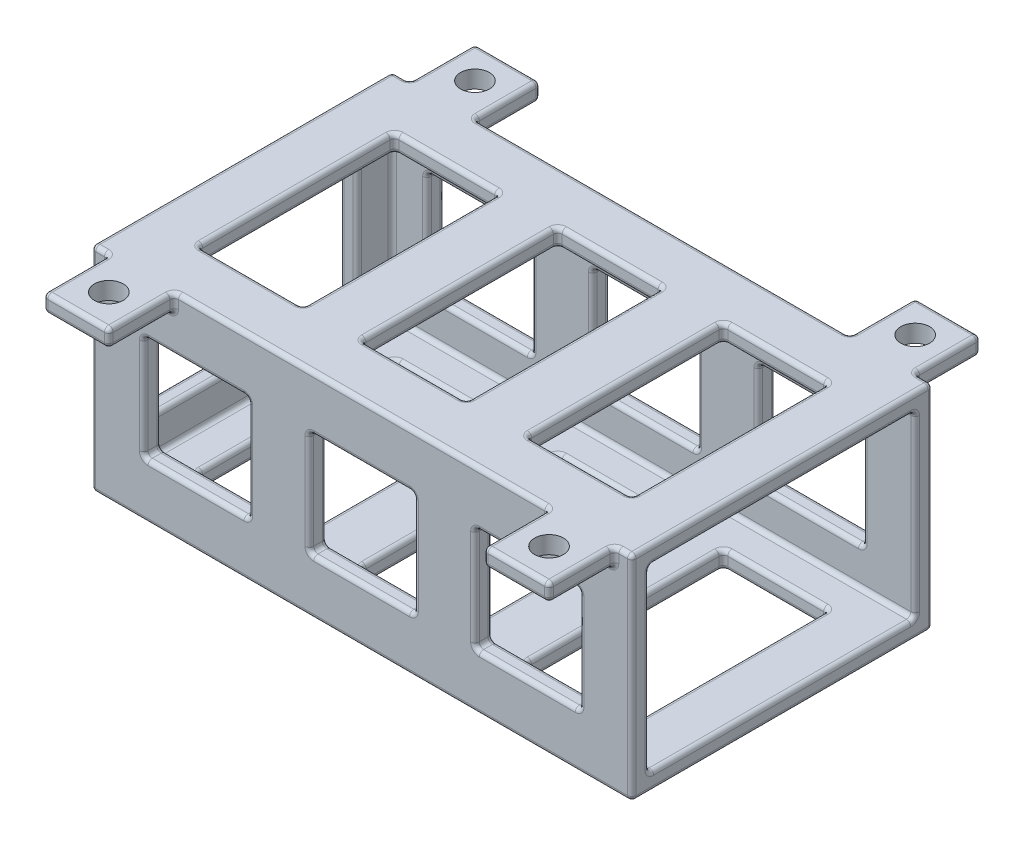
from build123d import *

# Parameters (mm, degrees)
SKETCH1_W           = 34.5
SKETCH1_H           = 24.5
BOSS_EXTRUDE1_DEPTH = 31
SHELL1_T            = -2
SKETCH2_W           = 7.5
SKETCH2_H           = 7.5
SKETCH2_R           = 1.65
BOSS_EXTRUDE2_DEPTH = 2
CUT_EXTRUDE3_REACH  = 55.62
SKETCH5_W           = 12
SKETCH5_H           = 12
CUT_EXTRUDE4_REACH  = 48.624
SKETCH6_W           = 12
SKETCH6_H           = 22.5
SKETCH7_W           = 22.5
SKETCH7_H           = 12.5
CUT_EXTRUDE5_DEPTH  = 2
FILLET1_R           = 0.5


with BuildPart() as part:
    # Sketch1 → Boss-Extrude1 (new, symmetric)
    with BuildSketch(Plane(origin=(0, 0, 0), x_dir=(0, 0, -1), z_dir=(1, 0, 0))):
        Rectangle(SKETCH1_W, SKETCH1_H)
    extrude(amount=BOSS_EXTRUDE1_DEPTH, both=True)

    # Shell1
    shell1_openings = [part.faces().sort_by_distance(p)[0] for p in [
        (31, 0, 0),
    ]]
    offset(amount=SHELL1_T, openings=shell1_openings, kind=Kind.INTERSECTION)

    # Sketch2 → Boss-Extrude2 (add)
    # profile 1 of 4: a face of its own
    with BuildSketch(Plane(origin=(0, 12.25, 0), x_dir=(1, 0, 0), z_dir=(0, 1, 0))):
        with Locations((-25.25, 21)):
            Rectangle(SKETCH2_W, SKETCH2_H)
        with Locations(Location((-25.25, 21, 0), (0, 0, 270))):
            Circle(SKETCH2_R, mode=Mode.SUBTRACT)
    # profile 2 of 4: a face of its own
    with BuildSketch(Plane(origin=(0, 12.25, 0), x_dir=(1, 0, 0), z_dir=(0, 1, 0))):
        with Locations((25.25, 21)):
            Rectangle(SKETCH2_W, SKETCH2_H)
        with Locations(Location((25.25, 21, 0), (0, 0, 90))):
            Circle(SKETCH2_R, mode=Mode.SUBTRACT)
    # profile 3 of 4: a face of its own
    with BuildSketch(Plane(origin=(0, 12.25, 0), x_dir=(1, 0, 0), z_dir=(0, 1, 0))):
        with Locations((25.25, -21)):
            Rectangle(SKETCH2_W, SKETCH2_H)
        with Locations(Location((25.25, -21, 0), (0, 0, 270))):
            Circle(SKETCH2_R, mode=Mode.SUBTRACT)
    # profile 4 of 4: a face of its own
    with BuildSketch(Plane(origin=(0, 12.25, 0), x_dir=(1, 0, 0), z_dir=(0, 1, 0))):
        with Locations((-25.25, -21)):
            Rectangle(SKETCH2_W, SKETCH2_H)
        with Locations(Location((-25.25, -21, 0), (0, 0, 90))):
            Circle(SKETCH2_R, mode=Mode.SUBTRACT)
    extrude(amount=-BOSS_EXTRUDE2_DEPTH)

    # Cut-Extrude3: up to this face of the body (flat: up to its plane)
    cut_extrude3_end = Plane(part.part.faces().sort_by_distance((0, -0.226662189, 17.25))[0])
    # Sketch5 → Cut-Extrude3 (cut, up to the picked face)
    with BuildSketch(Plane(origin=(0, 0, -17.25), x_dir=(-1, 0, 0), z_dir=(0, 0, -1)), mode=Mode.PRIVATE) as cut_extrude3_sk1:
        with Locations((-19, 0)):
            Rectangle(SKETCH5_W, SKETCH5_H)
    cut_extrude3_tool1 = split(extrude(cut_extrude3_sk1.sketch, amount=-CUT_EXTRUDE3_REACH, mode=Mode.PRIVATE), bisect_by=cut_extrude3_end, keep=Keep.BOTH, mode=Mode.PRIVATE)
    # Sketch5 → Cut-Extrude3 (cut, up to the picked face)
    with BuildSketch(Plane(origin=(0, 0, -17.25), x_dir=(-1, 0, 0), z_dir=(0, 0, -1)), mode=Mode.PRIVATE) as cut_extrude3_sk2:
        Rectangle(SKETCH5_W, SKETCH5_H)
    cut_extrude3_tool2 = split(extrude(cut_extrude3_sk2.sketch, amount=-CUT_EXTRUDE3_REACH, mode=Mode.PRIVATE), bisect_by=cut_extrude3_end, keep=Keep.BOTH, mode=Mode.PRIVATE)
    # Sketch5 → Cut-Extrude3 (cut, up to the picked face)
    with BuildSketch(Plane(origin=(0, 0, -17.25), x_dir=(-1, 0, 0), z_dir=(0, 0, -1)), mode=Mode.PRIVATE) as cut_extrude3_sk3:
        with Locations((19, 0)):
            Rectangle(SKETCH5_W, SKETCH5_H)
    cut_extrude3_tool3 = split(extrude(cut_extrude3_sk3.sketch, amount=-CUT_EXTRUDE3_REACH, mode=Mode.PRIVATE), bisect_by=cut_extrude3_end, keep=Keep.BOTH, mode=Mode.PRIVATE)
    add(cut_extrude3_tool1.solids().sort_by(Axis((19, 0, -17.25), (0, 0, 1)))[0], mode=Mode.SUBTRACT)
    add(cut_extrude3_tool2.solids().sort_by(Axis((0, 0, -17.25), (0, 0, 1)))[0], mode=Mode.SUBTRACT)
    add(cut_extrude3_tool3.solids().sort_by(Axis((-19, 0, -17.25), (0, 0, 1)))[0], mode=Mode.SUBTRACT)

    # Cut-Extrude4: up to this face of the body (flat: up to its plane)
    cut_extrude4_end = Plane(part.part.faces().sort_by_distance((0, -12.25, 0))[0])
    # Sketch6 → Cut-Extrude4 (cut, up to the picked face)
    with BuildSketch(Plane(origin=(0, 12.25, 0), x_dir=(1, 0, 0), z_dir=(0, 1, 0)), mode=Mode.PRIVATE) as cut_extrude4_sk1:
        with Locations((-18.733429366, 0)):
            Rectangle(SKETCH6_W, SKETCH6_H)
    cut_extrude4_tool1 = split(extrude(cut_extrude4_sk1.sketch, amount=-CUT_EXTRUDE4_REACH, mode=Mode.PRIVATE), bisect_by=cut_extrude4_end, keep=Keep.BOTH, mode=Mode.PRIVATE)
    # Sketch6 → Cut-Extrude4 (cut, up to the picked face)
    with BuildSketch(Plane(origin=(0, 12.25, 0), x_dir=(1, 0, 0), z_dir=(0, 1, 0)), mode=Mode.PRIVATE) as cut_extrude4_sk2:
        with Locations((19, 0)):
            Rectangle(SKETCH6_W, SKETCH6_H)
    cut_extrude4_tool2 = split(extrude(cut_extrude4_sk2.sketch, amount=-CUT_EXTRUDE4_REACH, mode=Mode.PRIVATE), bisect_by=cut_extrude4_end, keep=Keep.BOTH, mode=Mode.PRIVATE)
    # Sketch6 → Cut-Extrude4 (cut, up to the picked face)
    with BuildSketch(Plane(origin=(0, 12.25, 0), x_dir=(1, 0, 0), z_dir=(0, 1, 0)), mode=Mode.PRIVATE) as cut_extrude4_sk3:
        Rectangle(SKETCH6_W, SKETCH6_H)
    cut_extrude4_tool3 = split(extrude(cut_extrude4_sk3.sketch, amount=-CUT_EXTRUDE4_REACH, mode=Mode.PRIVATE), bisect_by=cut_extrude4_end, keep=Keep.BOTH, mode=Mode.PRIVATE)
    add(cut_extrude4_tool1.solids().sort_by(Axis((-18.733429, 12.25, 0), (0, -1, 0)))[0], mode=Mode.SUBTRACT)
    add(cut_extrude4_tool2.solids().sort_by(Axis((19, 12.25, 0), (0, -1, 0)))[0], mode=Mode.SUBTRACT)
    add(cut_extrude4_tool3.solids().sort_by(Axis((0, 12.25, 0), (0, -1, 0)))[0], mode=Mode.SUBTRACT)

    # Sketch7 → Cut-Extrude5 (cut)
    with BuildSketch(Plane.ZY.offset(31)):
        Rectangle(SKETCH7_W, SKETCH7_H)
    extrude(amount=-CUT_EXTRUDE5_DEPTH, mode=Mode.SUBTRACT)

    # Fillet1
    fillet1_edges = [part.edges().sort_by_distance(p)[0] for p in [
        (13, 6, 16.25),
        (13, 0, 15.25),
        (13, 0, 17.25),
        (25, 6, 16.25),
        (19, 6, 15.25),
        (19, 6, 17.25),
        (25, -6, 16.25),
        (25, 0, 15.25),
        (25, 0, 17.25),
        (13, -6, 16.25),
        (19, -6, 15.25),
        (19, -6, 17.25),
        (13, 6, -16.25),
        (13, 0, -17.25),
        (25, 6, -16.25),
        (19, 6, -17.25),
        (25, -6, -16.25),
        (25, 0, -17.25),
        (13, -6, -16.25),
        (19, -6, -17.25),
        (-6, 6, 16.25),
        (-6, 0, 15.25),
        (-6, 0, 17.25),
        (6, 6, 16.25),
        (0, 6, 15.25),
        (0, 6, 17.25),
        (6, -6, 16.25),
        (6, 0, 15.25),
        (6, 0, 17.25),
        (-6, -6, 16.25),
        (0, -6, 15.25),
        (0, -6, 17.25),
        (-6, 6, -16.25),
        (-6, 0, -17.25),
        (6, 6, -16.25),
        (0, 6, -17.25),
        (6, -6, -16.25),
        (6, 0, -17.25),
        (-6, -6, -16.25),
        (0, -6, -17.25),
        (-25, 6, 16.25),
        (-25, 0, 15.25),
        (-25, 0, 17.25),
        (31, 0, -17.25),
        (-13, 6, 16.25),
        (-19, 6, 15.25),
        (-19, 6, 17.25),
        (-13, -6, 16.25),
        (-13, 0, 15.25),
        (-13, 0, 17.25),
        (-25, -6, 16.25),
        (-19, -6, 15.25),
        (-19, -6, 17.25),
        (-25, 6, -16.25),
        (-25, 0, -17.25),
        (-13, 6, -16.25),
        (-19, 6, -17.25),
        (-13, -6, -16.25),
        (-13, 0, -17.25),
        (-25, -6, -16.25),
        (-19, -6, -17.25),
        (-29, 0, 15.25),
        (1, 10.25, 15.25),
        (-29, -10.25, 0),
        (1, -10.25, 15.25),
        (6, 10.25, 0),
        (0, 10.25, -11.25),
        (31, 12.25, 0),
        (-29, 0, -15.25),
        (-6, 10.25, 0),
        (0, 10.25, 11.25),
        (1, -10.25, -15.25),
        (25, 10.25, 0),
        (19, 10.25, -11.25),
        (-29, 10.25, 0),
        (13, 10.25, 0),
        (19, 10.25, 11.25),
        (1, 10.25, -15.25),
        (-12.733429366, 10.25, 0),
        (-18.733429366, 10.25, -11.25),
        (31, 0, 15.25),
        (-24.733429366, 10.25, 0),
        (-18.733429366, 10.25, 11.25),
        (31, -10.25, 0),
        (31, 0, -15.25),
        (31, 10.25, 0),
        (-18.733429366, -10.25, 11.25),
        (-12.733429366, -11.25, 11.25),
        (-24.733429366, -10.25, 0),
        (-24.733429366, -11.25, 11.25),
        (-18.733429366, -10.25, -11.25),
        (-24.733429366, -11.25, -11.25),
        (-12.733429366, -10.25, 0),
        (-12.733429366, -11.25, -11.25),
        (-12.733429366, 11.25, 11.25),
        (-24.733429366, 11.25, 11.25),
        (-24.733429366, 11.25, -11.25),
        (-12.733429366, 11.25, -11.25),
        (-18.733429366, 12.25, 11.25),
        (-12.733429366, 12.25, 0),
        (-18.733429366, 12.25, -11.25),
        (-24.733429366, 12.25, 0),
        (-18.733429366, -12.25, 11.25),
        (-24.733429366, -12.25, 0),
        (-18.733429366, -12.25, -11.25),
        (-12.733429366, -12.25, 0),
        (19, -10.25, 11.25),
        (25, -11.25, 11.25),
        (13, -10.25, 0),
        (13, -11.25, 11.25),
        (19, -10.25, -11.25),
        (13, -11.25, -11.25),
        (25, -10.25, 0),
        (25, -11.25, -11.25),
        (25, 11.25, 11.25),
        (13, 11.25, 11.25),
        (13, 11.25, -11.25),
        (25, 11.25, -11.25),
        (19, 12.25, 11.25),
        (25, 12.25, 0),
        (19, 12.25, -11.25),
        (13, 12.25, 0),
        (19, -12.25, 11.25),
        (13, -12.25, 0),
        (19, -12.25, -11.25),
        (25, -12.25, 0),
        (0, -10.25, 11.25),
        (6, -11.25, 11.25),
        (-6, -10.25, 0),
        (-6, -11.25, 11.25),
        (0, -10.25, -11.25),
        (-6, -11.25, -11.25),
        (6, -10.25, 0),
        (6, -11.25, -11.25),
        (6, 11.25, 11.25),
        (-6, 11.25, 11.25),
        (-6, 11.25, -11.25),
        (6, 11.25, -11.25),
        (0, 12.25, 11.25),
        (6, 12.25, 0),
        (0, 12.25, -11.25),
        (-6, 12.25, 0),
        (0, -12.25, 11.25),
        (-6, -12.25, 0),
        (0, -12.25, -11.25),
        (6, -12.25, 0),
        (-31, 6.25, 0),
        (-31, 0, -11.25),
        (-31, -6.25, 0),
        (-31, 0, 11.25),
        (-29, 0, -11.25),
        (-29, -6.25, 0),
        (-29, 0, 11.25),
        (-29, 6.25, 0),
        (-30, 12.25, -17.25),
        (-29, 10.25, -21),
        (-29, 11.25, -17.25),
        (-25.25, 10.25, -24.75),
        (-29, 11.25, -24.75),
        (-21.5, 10.25, -21),
        (-21.5, 11.25, -24.75),
        (-25.25, 10.25, -17.25),
        (-21.5, 11.25, -17.25),
        (-29, 12.25, -21),
        (-21.5, 12.25, -21),
        (-25.25, 12.25, -24.75),
        (0, 12.25, -17.25),
        (25.25, 10.25, -17.25),
        (29, 11.25, -17.25),
        (21.5, 10.25, -21),
        (21.5, 11.25, -17.25),
        (25.25, 10.25, -24.75),
        (21.5, 11.25, -24.75),
        (29, 10.25, -21),
        (29, 11.25, -24.75),
        (29, 12.25, -21),
        (25.25, 12.25, -24.75),
        (21.5, 12.25, -21),
        (31, 0, 17.25),
        (-31, 12.25, 0),
        (0, 12.25, 17.25),
        (29, 10.25, 21),
        (29, 11.25, 17.25),
        (25.25, 10.25, 24.75),
        (29, 11.25, 24.75),
        (21.5, 10.25, 21),
        (21.5, 11.25, 24.75),
        (25.25, 10.25, 17.25),
        (21.5, 11.25, 17.25),
        (-31, 0, -17.25),
        (29, 12.25, 21),
        (21.5, 12.25, 21),
        (25.25, 12.25, 24.75),
        (-31, -12.25, 0),
        (-31, 0, 17.25),
        (-30, 12.25, 17.25),
        (-25.25, 10.25, 17.25),
        (-29, 11.25, 17.25),
        (-21.5, 10.25, 21),
        (-21.5, 11.25, 17.25),
        (-25.25, 10.25, 24.75),
        (-21.5, 11.25, 24.75),
        (-29, 10.25, 21),
        (-29, 11.25, 24.75),
        (-29, 12.25, 21),
        (-25.25, 12.25, 24.75),
        (-21.5, 12.25, 21),
        (30, 12.25, 17.25),
        (30, 12.25, -17.25),
        (0, -12.25, -17.25),
        (0, -12.25, 17.25),
        (-19, -6, -15.25),
        (-13, 0, -15.25),
        (-19, 6, -15.25),
        (-25, 0, -15.25),
        (0, -6, -15.25),
        (6, 0, -15.25),
        (0, 6, -15.25),
        (-6, 0, -15.25),
        (19, -6, -15.25),
        (25, 0, -15.25),
        (19, 6, -15.25),
        (13, 0, -15.25),
        (31, -12.25, 0),
    ]]
    fillet(fillet1_edges, radius=FILLET1_R)


solid = part.part
